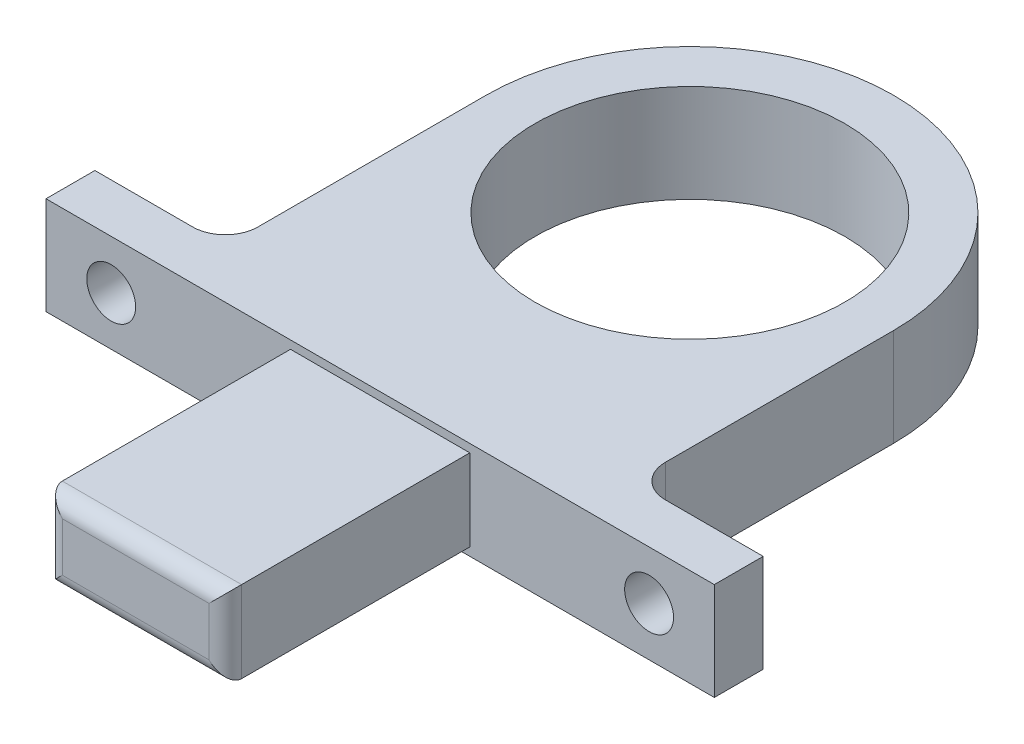
from build123d import *

# Parameters (mm, degrees)
CROQUIS1_R              = 9.5
SALIENTE_EXTRUIR1_DEPTH = 6
CROQUIS2_R              = 1.5
CORTAR_EXTRUIR1_DEPTH   = 6
CROQUIS3_R              = 3
CORTAR_EXTRUIR2_DEPTH   = 6
CROQUIS4_W              = 11
CROQUIS4_H              = 15
CORTAR_EXTRUIR3_DEPTH   = 0.5
CROQUIS5_W              = 11
CROQUIS5_H              = 15
CORTAR_EXTRUIR4_DEPTH   = 0.5
REDONDEO1_R             = 1


with BuildPart() as part:
    # Croquis1 → Saliente-Extruir1 (new body)
    with BuildSketch(Plane(origin=(0, 0, 0), x_dir=(1, 0, 0), z_dir=(0, 1, 0))):
        with BuildLine():
            Line((12.5, -14), (12.5, 0))
            ThreePointArc((12.5, 0), (0, 12.5), (-12.5, 0))
            Line((-12.5, 0), (-12.5, -14))
            ThreePointArc((-12.5, -14), (-13.085786438, -15.414213562), (-14.5, -16))
            Line((-14.5, -16), (-20.5, -16))
            Line((-20.5, -16), (-20.5, -19))
            Line((-20.5, -19), (-5.5, -19))
            Line((-5.5, -19), (-5.5, -34))
            Line((-5.5, -34), (5.5, -34))
            Line((5.5, -34), (5.5, -19))
            Line((5.5, -19), (20.5, -19))
            Line((20.5, -19), (20.5, -16))
            Line((20.5, -16), (14.5, -16))
            ThreePointArc((14.5, -16), (13.085786438, -15.414213562), (12.5, -14))
        make_face()
        Circle(CROQUIS1_R, mode=Mode.SUBTRACT)
    extrude(amount=SALIENTE_EXTRUIR1_DEPTH)

    # Croquis2 → Cortar-Extruir1 (cut)
    with BuildSketch(Plane.XY.offset(19)):
        with Locations((-16.5, 3)):
            Circle(CROQUIS2_R)
        with Locations((16.5, 3)):
            Circle(CROQUIS2_R)
    extrude(amount=-CORTAR_EXTRUIR1_DEPTH, mode=Mode.SUBTRACT)

    # Croquis3 → Cortar-Extruir2 (cut)
    with BuildSketch(Plane(origin=(0, 0, 16), x_dir=(-1, 0, 0), z_dir=(0, 0, -1))):
        with Locations((-16.5, 3)):
            Circle(CROQUIS3_R)
        with Locations((16.5, 3)):
            Circle(CROQUIS3_R)
    extrude(amount=CORTAR_EXTRUIR2_DEPTH, mode=Mode.SUBTRACT)

    # Croquis4 → Cortar-Extruir3 (cut)
    with BuildSketch(Plane.XZ):
        with Locations((0, 26.5)):
            Rectangle(CROQUIS4_W, CROQUIS4_H)
    extrude(amount=-CORTAR_EXTRUIR3_DEPTH, mode=Mode.SUBTRACT)

    # Croquis5 → Cortar-Extruir4 (cut)
    with BuildSketch(Plane(origin=(0, 6, 0), x_dir=(1, 0, 0), z_dir=(0, 1, 0))):
        with Locations((0, -26.5)):
            Rectangle(CROQUIS5_W, CROQUIS5_H)
    extrude(amount=-CORTAR_EXTRUIR4_DEPTH, mode=Mode.SUBTRACT)

    # Redondeo1
    redondeo1_edges = [part.edges().sort_by_distance(p)[0] for p in [
        (5.5, 3, 34),
        (0, 0.5, 34),
        (-5.5, 3, 34),
        (0, 5.5, 34),
    ]]
    fillet(redondeo1_edges, radius=REDONDEO1_R)


solid = part.part
